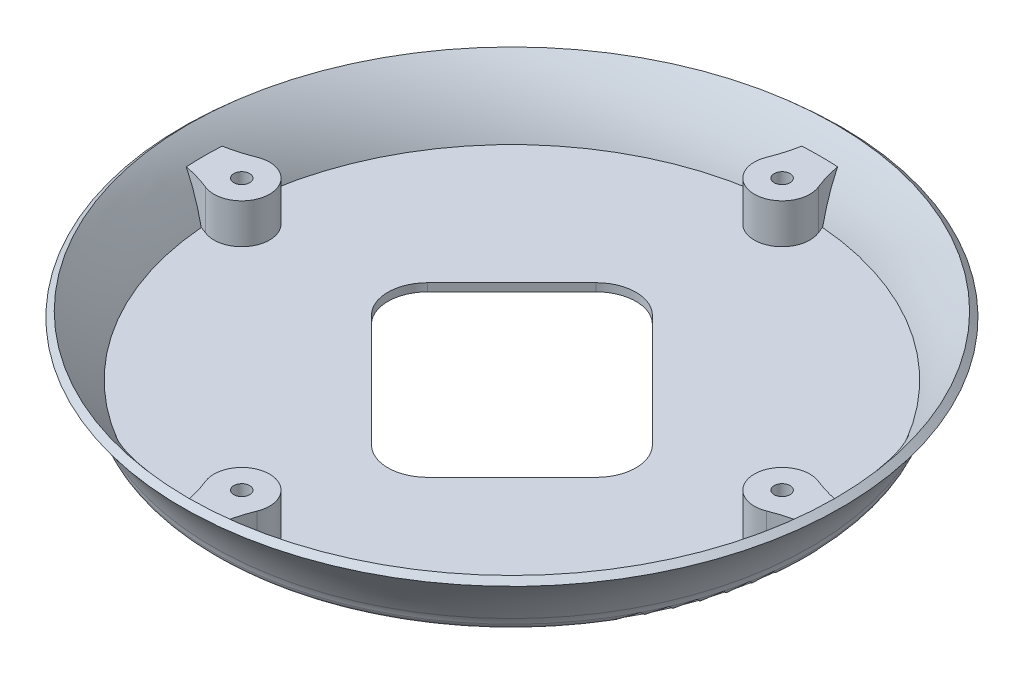
from build123d import *

# Parameters (mm, degrees)
BOSS_EXTRUDE1_REACH            = 121.943
SKETCH2_R                      = 2
CUT_EXTRUDE1_REACH             = 123.084
SKETCH4_W                      = 180
SKETCH4_H                      = 15
CUT_EXTRUDE1_DIRECTION_2_REACH = 123.084
SKETCH5_R                      = 74.701116641
SKETCH5_R_2                    = 2
BOSS_EXTRUDE2_DEPTH            = 2
SKETCH6_R                      = 5
CUT_EXTRUDE2_DEPTH             = 8
FILLET1_R                      = 2
FILLET2_R                      = 10
CUT_EXTRUDE3_REACH             = 120.264


with BuildPart() as part:
    # Sketch1 → Revolve-Thin1 (revolve)
    with BuildSketch(Plane.XY, mode=Mode.PRIVATE) as revolve_thin1_sk:
        with BuildLine():
            ThreePointArc((-70, 0), (-72.962243847, 16.05699404), (-81.458980338, 30))
            Line((-81.458980338, 30), (-82.949692323, 28.666666667))
            ThreePointArc((-82.949692323, 28.666666667), (-74.830588565, 15.34334986), (-72, 0))
            Line((-72, 0), (-70, 0))
        make_face()
    revolve(revolve_thin1_sk.sketch.rotate(Axis((0, 0, 0), (0, 1, 0)), 270), axis=Axis((0, 0, 0), (0, 1, 0)))

    # Boss-Extrude1: up to this face of the body (flat: up to its plane)
    boss_extrude1_end = Plane(part.part.faces().sort_by_distance((0, 0, 71.796353247))[0])
    # Sketch2 → Boss-Extrude1 (add, up to the picked face)
    with BuildSketch(Plane(origin=(0, 25, 0), x_dir=(-1, 0, 0), z_dir=(0, -1, 0)), mode=Mode.PRIVATE) as boss_extrude1_sk1:
        with BuildLine():
            ThreePointArc((6.495313924, -70.609769534), (4.324225171, -78.519680843), (4, -86.715728753))
            Line((4, -86.715728753), (-4, -86.715728753))
            ThreePointArc((-4, -86.715728753), (-4.324225171, -78.519680843), (-6.495313924, -70.609769534))
            ThreePointArc((-6.495313924, -70.609769534), (0, -61), (6.495313924, -70.609769534))
        make_face()
        with Locations(Location((0, -68, 0), (0, 0, 90))):
            Circle(SKETCH2_R, mode=Mode.SUBTRACT)
    boss_extrude1_tool1 = split(extrude(boss_extrude1_sk1.sketch, amount=BOSS_EXTRUDE1_REACH, mode=Mode.PRIVATE), bisect_by=boss_extrude1_end, keep=Keep.BOTH, mode=Mode.PRIVATE)
    # Sketch2 → Boss-Extrude1 (add, up to the picked face)
    with BuildSketch(Plane(origin=(0, 25, 0), x_dir=(-1, 0, 0), z_dir=(0, -1, 0)), mode=Mode.PRIVATE) as boss_extrude1_sk2:
        with BuildLine():
            ThreePointArc((70.609769534, 6.495313924), (78.519680843, 4.324225171), (86.715728753, 4))
            Line((86.715728753, 4), (86.715728753, -4))
            ThreePointArc((86.715728753, -4), (78.519680843, -4.324225171), (70.609769534, -6.495313924))
            ThreePointArc((70.609769534, -6.495313924), (61, 0), (70.609769534, 6.495313924))
        make_face()
        with Locations(Location((68, 0, 0), (0, 0, 90))):
            Circle(SKETCH2_R, mode=Mode.SUBTRACT)
    boss_extrude1_tool2 = split(extrude(boss_extrude1_sk2.sketch, amount=BOSS_EXTRUDE1_REACH, mode=Mode.PRIVATE), bisect_by=boss_extrude1_end, keep=Keep.BOTH, mode=Mode.PRIVATE)
    # Sketch2 → Boss-Extrude1 (add, up to the picked face)
    with BuildSketch(Plane(origin=(0, 25, 0), x_dir=(-1, 0, 0), z_dir=(0, -1, 0)), mode=Mode.PRIVATE) as boss_extrude1_sk3:
        with BuildLine():
            ThreePointArc((-6.495313924, 70.609769534), (-4.324225171, 78.519680843), (-4, 86.715728753))
            Line((-4, 86.715728753), (4, 86.715728753))
            ThreePointArc((4, 86.715728753), (4.324225171, 78.519680843), (6.495313924, 70.609769534))
            ThreePointArc((6.495313924, 70.609769534), (0, 61), (-6.495313924, 70.609769534))
        make_face()
        with Locations(Location((0, 68, 0), (0, 0, 90))):
            Circle(SKETCH2_R, mode=Mode.SUBTRACT)
    boss_extrude1_tool3 = split(extrude(boss_extrude1_sk3.sketch, amount=BOSS_EXTRUDE1_REACH, mode=Mode.PRIVATE), bisect_by=boss_extrude1_end, keep=Keep.BOTH, mode=Mode.PRIVATE)
    # Sketch2 → Boss-Extrude1 (add, up to the picked face)
    with BuildSketch(Plane(origin=(0, 25, 0), x_dir=(-1, 0, 0), z_dir=(0, -1, 0)), mode=Mode.PRIVATE) as boss_extrude1_sk4:
        with BuildLine():
            ThreePointArc((-81.360361137, 4.007132799), (-81.434321805, 2.004173085), (-81.458980338, 0))
            ThreePointArc((-81.458980338, 0), (-81.434321805, -2.004173085), (-81.360361137, -4.007132799))
            ThreePointArc((-81.360361137, -4.007132799), (-75.887045081, -4.837355971), (-70.605732867, -6.496934371))
            ThreePointArc((-70.605732867, -6.496934371), (-61, 0), (-70.605732867, 6.496934371))
            ThreePointArc((-70.605732867, 6.496934371), (-75.887045081, 4.837355971), (-81.360361137, 4.007132799))
        make_face()
        with Locations(Location((-68, 0, 0), (0, 0, 90))):
            Circle(SKETCH2_R, mode=Mode.SUBTRACT)
    boss_extrude1_tool4 = split(extrude(boss_extrude1_sk4.sketch, amount=BOSS_EXTRUDE1_REACH, mode=Mode.PRIVATE), bisect_by=boss_extrude1_end, keep=Keep.BOTH, mode=Mode.PRIVATE)
    add(boss_extrude1_tool1.solids().sort_by(Axis((0, 25, 73.20964), (0, -1, 0)))[0])
    add(boss_extrude1_tool2.solids().sort_by(Axis((-73.20964, 25, 0), (0, -1, 0)))[0])
    add(boss_extrude1_tool3.solids().sort_by(Axis((0, 25, -73.20964), (0, -1, 0)))[0])
    add(boss_extrude1_tool4.solids().sort_by(Axis((71.031369, 25, 0), (0, -1, 0)))[0])

    # Sketch3 → Cut-Revolve1 (revolve, cut)
    with BuildSketch(Plane.XY, mode=Mode.PRIVATE) as cut_revolve1_sk:
        with BuildLine():
            Line((-72, 0), (-99.127196695, 0))
            Line((-99.127196695, 0), (-99.127196695, 28.666666667))
            Line((-99.127196695, 28.666666667), (-82.949692323, 28.666666667))
            ThreePointArc((-82.949692323, 28.666666667), (-74.830588565, 15.34334986), (-72, 0))
        make_face()
    revolve(cut_revolve1_sk.sketch.rotate(Axis((0, 0, 0), (0, 1, 0)), 270), axis=Axis((0, 0, 0), (0, 1, 0)), mode=Mode.SUBTRACT)

    # Sketch4 → Cut-Extrude1 (cut, up to next)
    with BuildSketch(Plane(origin=(0, 0, 0), x_dir=(0, 0, -1), z_dir=(1, 0, 0)), mode=Mode.PRIVATE) as cut_extrude1_sk1:
        with Locations((0, 7.5)):
            Rectangle(SKETCH4_W, SKETCH4_H)
    cut_extrude1_tool1 = extrude(cut_extrude1_sk1.sketch, amount=-CUT_EXTRUDE1_REACH, mode=Mode.PRIVATE) & part.part
    add(cut_extrude1_tool1.solids().sort_by_distance((0, 7.5, 0))[0], mode=Mode.SUBTRACT)

    # Sketch4 → Cut-Extrude1 direction 2 (cut, up to next)
    with BuildSketch(Plane(origin=(0, 0, 0), x_dir=(0, 0, -1), z_dir=(1, 0, 0)), mode=Mode.PRIVATE) as cut_extrude1_direction_2_sk1:
        with Locations((0, 7.5)):
            Rectangle(SKETCH4_W, SKETCH4_H)
    cut_extrude1_direction_2_tool1 = extrude(cut_extrude1_direction_2_sk1.sketch, amount=CUT_EXTRUDE1_DIRECTION_2_REACH, mode=Mode.PRIVATE) & part.part
    add(cut_extrude1_direction_2_tool1.solids().sort_by_distance((0, 7.5, 0))[0], mode=Mode.SUBTRACT)

    # Sketch5 → Boss-Extrude2 (add)
    with BuildSketch(Plane.XZ.offset(-15)):
        with Locations(Location((0, 0, 0), (0, 0, 270))):
            Circle(SKETCH5_R)
        with Locations(Location((68, 0, 0), (0, 0, 270))):
            Circle(SKETCH5_R_2, mode=Mode.SUBTRACT)
        with Locations(Location((0, 68, 0), (0, 0, 270))):
            Circle(SKETCH5_R_2, mode=Mode.SUBTRACT)
        with Locations(Location((-68, 0, 0), (0, 0, 270))):
            Circle(SKETCH5_R_2, mode=Mode.SUBTRACT)
        with Locations(Location((0, -68, 0), (0, 0, 270))):
            Circle(SKETCH5_R_2, mode=Mode.SUBTRACT)
    extrude(amount=BOSS_EXTRUDE2_DEPTH)

    # Sketch6 → Cut-Extrude2 (cut)
    with BuildSketch(Plane.XZ.offset(-13)):
        with Locations(Location((0, 68, 0), (0, 0, 270))):
            Circle(SKETCH6_R)
        with Locations(Location((68, 0, 0), (0, 0, 270))):
            Circle(SKETCH6_R)
        with Locations(Location((0, -68, 0), (0, 0, 270))):
            Circle(SKETCH6_R)
        with Locations(Location((-68, 0, 0), (0, 0, 270))):
            Circle(SKETCH6_R)
    extrude(amount=-CUT_EXTRUDE2_DEPTH, mode=Mode.SUBTRACT)

    # Fillet1
    # the kernel refuses this fillet: 2 mm, written as the material it takes off along each edge
    with BuildSketch(Plane(origin=(0, 13, 0), x_dir=(0, 0, -1), z_dir=(-1, 0, 0))) as fillet1_piece_1:
        with BuildLine():
            CenterArc((74.701116641 - FILLET1_R, -FILLET1_R), FILLET1_R, 0, 90)
            Line((74.701116641 - FILLET1_R, 0), (74.701116641, 0))
            Line((74.701116641, 0), (74.701116641, -FILLET1_R))
        make_face()
    revolve(axis=Axis((0, 13, 0), (0, -1, 0)), mode=Mode.SUBTRACT)

    # Fillet2
    fillet2_edges = [part.edges().sort_by_distance(p)[0] for p in [
        (0, 15, 74.701116641),
    ]]
    fillet(fillet2_edges, radius=FILLET2_R)

    # Sketch7 → Cut-Extrude3 (cut, up to next)
    with BuildSketch(Plane(origin=(0, 15, 0), x_dir=(1, 0, 0), z_dir=(0, 1, 0)), mode=Mode.PRIVATE) as cut_extrude3_sk1:
        with BuildLine():
            Line((10.606601718, -31.819805153), (31.819805153, -10.606601718))
            ThreePointArc((31.819805153, -10.606601718), (34.748737342, -3.535533906), (31.819805153, 3.535533906))
            Line((31.819805153, 3.535533906), (3.535533906, 31.819805153))
            ThreePointArc((3.535533906, 31.819805153), (-3.535533906, 34.748737342), (-10.606601718, 31.819805153))
            Line((-10.606601718, 31.819805153), (-31.819805153, 10.606601718))
            ThreePointArc((-31.819805153, 10.606601718), (-34.748737342, 3.535533906), (-31.819805153, -3.535533906))
            Line((-31.819805153, -3.535533906), (-3.535533906, -31.819805153))
            ThreePointArc((-3.535533906, -31.819805153), (3.535533906, -34.748737342), (10.606601718, -31.819805153))
        make_face()
    cut_extrude3_tool1 = extrude(cut_extrude3_sk1.sketch, amount=-CUT_EXTRUDE3_REACH, mode=Mode.PRIVATE) & part.part
    add(cut_extrude3_tool1.solids().sort_by_distance((0, 15, 0))[0], mode=Mode.SUBTRACT)


solid = part.part
